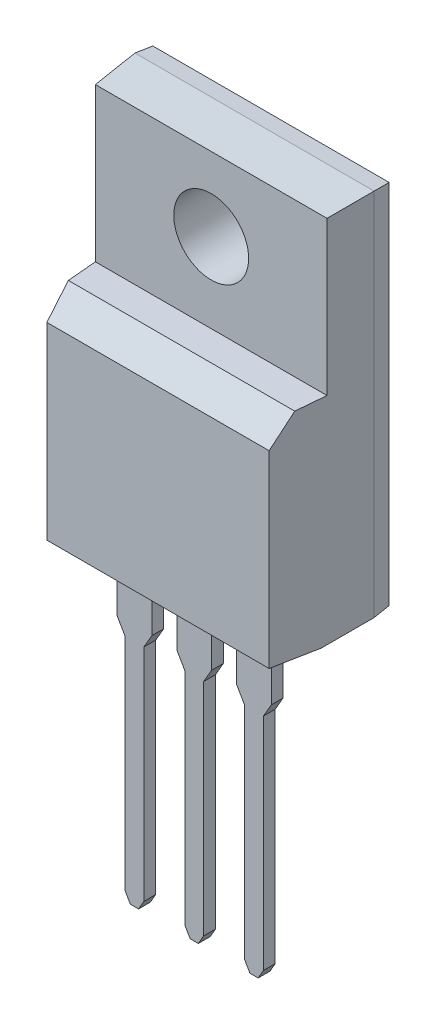
from build123d import *

# Parameters (mm, degrees)
SKETCH1_W          = 10.16
SKETCH1_H          = 15.87
SKETCH1_R          = 1.59
EXTRUDE1_DEPTH     = 4.8
SKETCH2_W          = 4.533761675
SKETCH2_H          = 11.038854263
CUT_EXTRUDE1_DEPTH = 5.5
CHAMFER1_SIZE      = 1
EXTRUDE2_DEPTH     = 0.5
DRAFT1_START       = -14
DRAFT1_DEPTH       = 17.3
DRAFT1_START_2     = 3.226433484
DRAFT1_2_OUTLINE_W = 14
DRAFT1_2_OUTLINE_H = 3
DRAFT1_2_DEPTH     = 0.773566516
DRAFT2_ANGLE       = -5
DRAFT4_START       = -5.08
DRAFT4_DEPTH       = 10.16
DRAFT4_2_DEPTH     = 1.805
DRAFT4_START_2     = 3.275
DRAFT4_3_DEPTH     = 1.805
DRAFT4_START_3     = -1.805
DRAFT4_4_DEPTH     = 1.07
DRAFT4_START_4     = 0.735
DRAFT4_5_DEPTH     = 1.07
DRAFT3_ANGLE       = 5


with BuildPart() as part:
    # Sketch1 → Extrude1 (new body)
    with BuildSketch(Plane.XY):
        with Locations((0, -4.635)):
            Rectangle(SKETCH1_W, SKETCH1_H)
        Circle(SKETCH1_R, mode=Mode.SUBTRACT)
    extrude(amount=EXTRUDE1_DEPTH)

    # Sketch2 → Cut-Extrude1 (cut, symmetric)
    with BuildSketch(Plane(origin=(0, 0, 0), x_dir=(0, 0, -1), z_dir=(1, 0, 0))):
        with Locations((-4.806880837, 2.139427131)):
            Rectangle(SKETCH2_W, SKETCH2_H)
    extrude(amount=CUT_EXTRUDE1_DEPTH, both=True, mode=Mode.SUBTRACT)

    # Chamfer1
    chamfer1_edges = [part.edges().sort_by_distance(p)[0] for p in [
        (0, -3.38, 4.8),
    ]]
    chamfer(chamfer1_edges, length=CHAMFER1_SIZE)

    # Sketch3 → Extrude2 (add)
    with BuildSketch(Plane.XY.offset(2.76)):
        Polygon((0.735, -12.57), (0.735, -15.219762979), (0.4, -15.8), (0.4, -25.160288568), (0.175, -25.55), (-0.175, -25.55), (-0.4, -25.160288568), (-0.4, -15.8), (-0.735, -15.219762979), (-0.735, -12.57), align=None)
        Polygon((3.275, -12.57), (1.805, -12.57), (1.805, -15.219762979), (2.14, -15.8), (2.14, -25.160288568), (2.365, -25.55), (2.715, -25.55), (2.94, -25.160288568), (2.94, -15.8), (3.275, -15.219762979), align=None)
        Polygon((-1.805, -12.57), (-3.275, -12.57), (-3.275, -15.219762979), (-2.94, -15.8), (-2.94, -25.160288568), (-2.715, -25.55), (-2.365, -25.55), (-2.14, -25.160288568), (-2.14, -15.8), (-1.805, -15.219762979), align=None)
    extrude(amount=EXTRUDE2_DEPTH)

    # Draft1: read off the stored shape, not the designer's step
    # Draft1 outline → Draft1 (cut)
    with BuildSketch(Plane(origin=(0, 0, 0), x_dir=(1, 0, 0), z_dir=(0, 1, 0)).offset(DRAFT1_START)):
        Polygon((5.08, 0), (5.018757936, 0), (5.08, -0.7), align=None)
        Polygon((-5.08, -0.7), (-5.018757936, 0), (-5.08, 0), align=None)
    extrude(amount=DRAFT1_DEPTH, mode=Mode.SUBTRACT)

    # Draft1 2 outline → Draft1 2 (cut)
    with BuildSketch(Plane(origin=(0, 0, 0), x_dir=(1, 0, 0), z_dir=(0, 0.9961946980917455, -0.08715574274765836)).offset(DRAFT1_START_2)):
        with Locations((0, -0.5)):
            Rectangle(DRAFT1_2_OUTLINE_W, DRAFT1_2_OUTLINE_H)
    extrude(amount=DRAFT1_2_DEPTH, mode=Mode.SUBTRACT)

    # Draft2
    draft2_faces = [part.faces().sort_by_distance(p)[0] for p in [
        (5.08, -6.046569578, 2.451893477),
        (-5.08, -6.046569578, 2.451893477),
        (0, 3.3, 1.62),
    ]]
    draft(draft2_faces, Plane(origin=(0, 0, 0.7), x_dir=(-1, 0, 0), z_dir=(0, 0, -1)), DRAFT2_ANGLE)

    # Draft4: read off the stored shape, not the designer's step
    # Draft4 outline → Draft4 (cut)
    with BuildSketch(Plane.YZ.offset(DRAFT4_START)):
        Polygon((-12.526255668, 3.26), (-12.391523126, 4.8), (-12.57, 4.8), (-12.57, 3.26), align=None)
    extrude(amount=DRAFT4_DEPTH, mode=Mode.SUBTRACT)

    # Draft4 2 outline → Draft4 2 (cut)
    with BuildSketch(Plane.YZ.offset(DRAFT4_START)):
        Polygon((-12.57, 2.76), (-12.526255668, 3.26), (-12.57, 3.26), align=None)
    extrude(amount=DRAFT4_2_DEPTH, mode=Mode.SUBTRACT)

    # Draft4 3 outline → Draft4 3 (cut)
    with BuildSketch(Plane.YZ.offset(DRAFT4_START_2)):
        Polygon((-12.57, 2.76), (-12.526255668, 3.26), (-12.57, 3.26), align=None)
    extrude(amount=DRAFT4_3_DEPTH, mode=Mode.SUBTRACT)

    # Draft4 4 outline → Draft4 4 (cut)
    with BuildSketch(Plane.YZ.offset(DRAFT4_START_3)):
        Polygon((-12.57, 2.76), (-12.526255668, 3.26), (-12.57, 3.26), align=None)
    extrude(amount=DRAFT4_4_DEPTH, mode=Mode.SUBTRACT)

    # Draft4 5 outline → Draft4 5 (cut)
    with BuildSketch(Plane.YZ.offset(DRAFT4_START_4)):
        Polygon((-12.57, 2.76), (-12.526255668, 3.26), (-12.57, 3.26), align=None)
    extrude(amount=DRAFT4_5_DEPTH, mode=Mode.SUBTRACT)

    # Draft3
    draft3_faces = [part.faces().sort_by_distance(p)[0] for p in [
        (0, -12.57, 1.372462039),
    ]]
    draft(draft3_faces, Plane(origin=(0, 0, 2.76), x_dir=(-1, 0, 0), z_dir=(0, 0, -1)), DRAFT3_ANGLE)


solid = part.part
